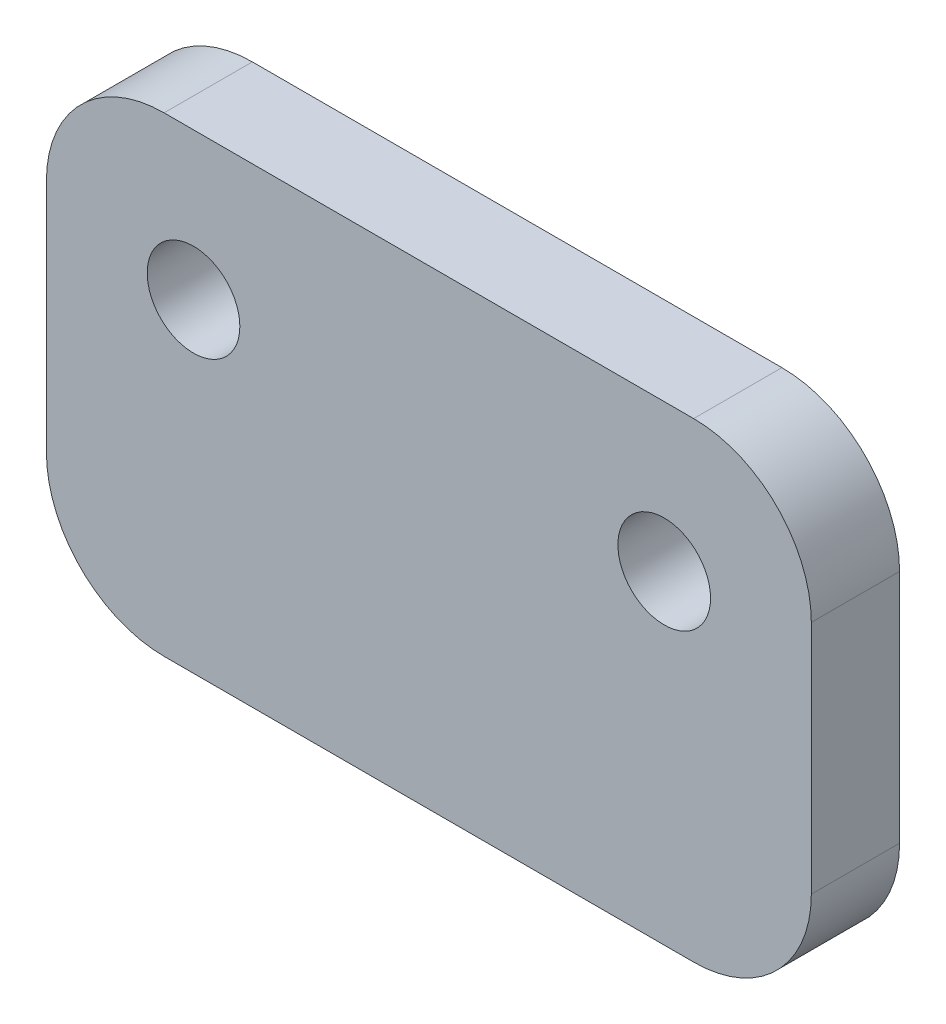
from build123d import *

# Parameters (mm, degrees)
SKETCH1_W             = 41.275
SKETCH1_H             = 25.4
BASE_FLANGE1_DEPTH    = 4.7625
BREAK_CORNER1_DEPTH   = 4.7625
M6X1_0_TAPPED_HOLE1_D = 5


# Read off the part's stored shape, not the designer's step: Break-Corner1
# Sheet-metal steps are written as plain solids
with BuildPart() as part:
    # Sketch1 → Base-Flange1 (new body)
    with BuildSketch(Plane.XY):
        Rectangle(SKETCH1_W, SKETCH1_H)
    extrude(amount=BASE_FLANGE1_DEPTH)

    # Break-Corner1 outline → Break-Corner1 (cut)
    with BuildSketch(Plane.XY):
        with BuildLine():
            Line((-20.6375, 12.7), (-20.6375, 6.35))
            ThreePointArc((-20.6375, 6.35), (-18.777628061, 10.840128061), (-14.2875, 12.7))
            Line((-14.2875, 12.7), (-20.6375, 12.7))
        make_face()
        with BuildLine():
            ThreePointArc((-14.2875, -12.7), (-18.777628061, -10.840128061), (-20.6375, -6.35))
            Line((-20.6375, -6.35), (-20.6375, -12.7))
            Line((-20.6375, -12.7), (-14.2875, -12.7))
        make_face()
        with BuildLine():
            Line((20.6375, 12.7), (14.2875, 12.7))
            ThreePointArc((14.2875, 12.7), (18.777628061, 10.840128061), (20.6375, 6.35))
            Line((20.6375, 6.35), (20.6375, 12.7))
        make_face()
        with BuildLine():
            ThreePointArc((20.6375, -6.35), (18.777628061, -10.840128061), (14.2875, -12.7))
            Line((14.2875, -12.7), (20.6375, -12.7))
            Line((20.6375, -12.7), (20.6375, -6.35))
        make_face()
    extrude(amount=BREAK_CORNER1_DEPTH, mode=Mode.SUBTRACT)

    # M6x1.0 Tapped Hole1 (through all)
    with Locations(Plane.XY.offset(4.7625)):
        with Locations((-12.7, 4.7625), (12.7, 4.7625)):
            Hole(M6X1_0_TAPPED_HOLE1_D / 2)


solid = part.part
